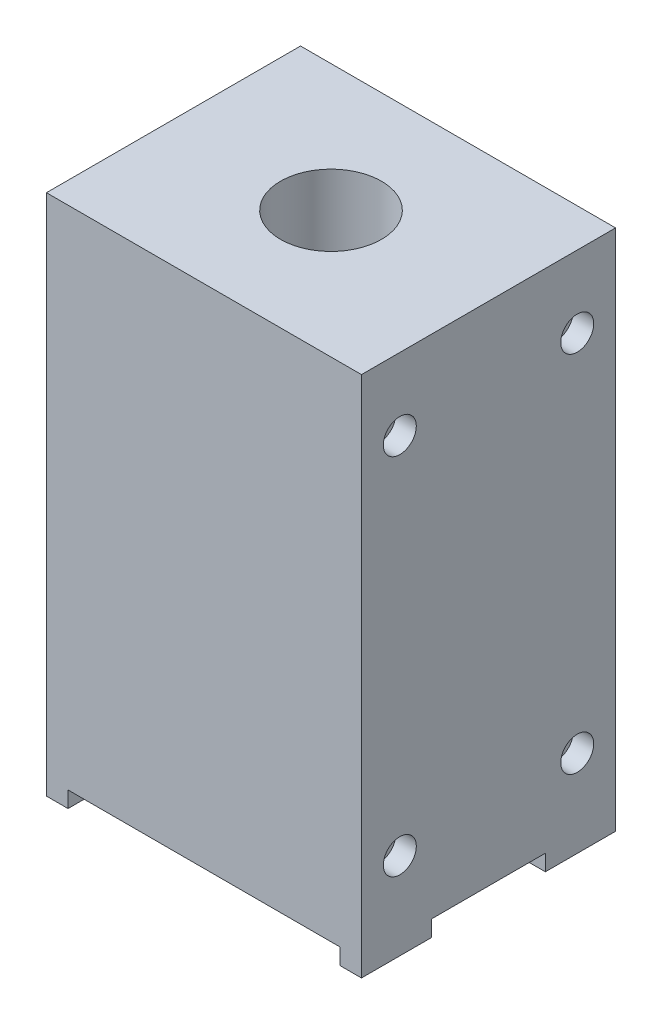
from build123d import *

# Parameters (mm, degrees)
BOSS_EXTRUDE1_DEPTH = 49.27
SKETCH12_W          = 2.099999999999998
SKETCH12_H          = 6.83
SKETCH12_W_2        = 2.0999999999999996
SKETCH12_H_2        = 6.829999999999998
SKETCH12_W_3        = 2.1000000000000014
BOSS_EXTRUDE2_DEPTH = 1.57
SKETCH4_R           = 4.91
CUT_EXTRUDE3_DEPTH  = 22
SKETCH5_R           = 2
CUT_EXTRUDE4_DEPTH  = 5
SKETCH7_R           = 1.5
CUT_EXTRUDE5_DEPTH  = 34.41594267711148
FILLET4_R           = 3
FILLET5_R           = 3
SKETCH13_R          = 1.6049999999999995
SKETCH13_R_2        = 1.6049999999999962
SKETCH13_R_3        = 1.605
CUT_EXTRUDE6_DEPTH  = 2


with BuildPart() as part:
    # Sketch2 → Boss-Extrude1 (new body)
    with BuildSketch(Plane(origin=(0, 0, 0), x_dir=(1, 0, 0), z_dir=(0, 1, 0))):
        Polygon((-15.325000000000001, 12.36), (15.324999999999998, 12.36), (15.325, -12.360000000000003), (-15.324999999999996, -12.360000000000003), align=None)
    extrude(amount=BOSS_EXTRUDE1_DEPTH)

    # Sketch12 → Boss-Extrude2 (add)
    with BuildSketch(Plane.XZ):
        with Locations((-14.274999999999997, 8.945000000000004)):
            Rectangle(SKETCH12_W, SKETCH12_H)
        with Locations((-14.275000000000002, -8.944999999999999)):
            Rectangle(SKETCH12_W_2, SKETCH12_H_2)
        with Locations((14.274999999999999, 8.945000000000004)):
            Rectangle(SKETCH12_W_3, SKETCH12_H)
        with Locations((14.274999999999999, -8.944999999999999)):
            Rectangle(SKETCH12_W_3, SKETCH12_H_2)
    extrude(amount=BOSS_EXTRUDE2_DEPTH)

    # Sketch4 → Cut-Extrude3 (cut)
    with BuildSketch(Plane(origin=(0, 49.27, 0), x_dir=(1, 0, 0), z_dir=(0, 1, 0))):
        with Locations(Location((0, 0, 0), (0, 0, 270))):
            Circle(SKETCH4_R)
    extrude(amount=-CUT_EXTRUDE3_DEPTH, mode=Mode.SUBTRACT)

    # Sketch5 → Cut-Extrude4 (cut)
    with BuildSketch(Plane(origin=(0, 27.270000000000003, 0), x_dir=(1, 0, 0), z_dir=(0, 1, 0))):
        with Locations(Location((0, 0, 0), (0, 0, 270))):
            Circle(SKETCH5_R)
    extrude(amount=-CUT_EXTRUDE4_DEPTH, mode=Mode.SUBTRACT)

    # Sketch7 → Cut-Extrude5 (cut, through all)
    with BuildSketch(Plane(origin=(0, 22.270000000000003, 0), x_dir=(1, 0, 0), z_dir=(0, 1, 0))):
        with Locations(Location((0, 0, 0), (0, 0, 270))):
            Circle(SKETCH7_R)
    extrude(amount=-CUT_EXTRUDE5_DEPTH, mode=Mode.SUBTRACT)

    # Fillet4
    # the kernel refuses this fillet: 3 mm, written as the material it takes off along each edge
    with BuildSketch(Plane(origin=(0, 27.270000000000003, 0), x_dir=(-1.8e-16, 0, 1), z_dir=(-1, 0, -1.8e-16))) as fillet4_piece_1:
        with BuildLine():
            CenterArc((5, -2.9986496961132367), FILLET4_R, 91.7191313208778, 88.2808686791222)
            Line((2, -2.9986496961132367), (1.94, -2.9986496961132367))
            Line((1.94, -2.9986496961132367), (1.94, 0))
            Line((1.94, 0), (2, 0.05999999999999872))
            ThreePointArc((2, 0.05999999999999872), (3.455, 0.05999999999999872), (4.9082, 0.05997299392226552))
            Line((4.9082, 0.05997299392226552), (4.91, 0))
        make_face()
    revolve(axis=Axis((0, 27.270000000000003, 0), (0, 1, 0)), mode=Mode.SUBTRACT)

    # Fillet5
    # the kernel refuses this fillet: 3 mm, written as the material it takes off along each edge
    with BuildSketch(Plane(origin=(0, 22.270000000000003, 0), x_dir=(-1.8e-16, 0, 1), z_dir=(-1, 0, -1.8e-16))) as fillet5_piece_1:
        with BuildLine():
            CenterArc((4.5, -1.6583123951831418), FILLET5_R, 146.44269023799268, 33.55730976200732)
            Line((2.0000000000025064, -1.66267e-12), (1.9500000000025566, 0.03316624790196698))
            ThreePointArc((1.9500000000025566, 0.03316624790196698), (1.7500000000012532, 0.05999999999999872), (1.5, 0.05999999999999872))
            Line((1.5, 0.05999999999999872), (1.44, 0))
            Line((1.44, 0), (1.44, -1.6583123951831418))
            Line((1.44, -1.6583123951831418), (1.5, -1.6583123951831418))
        make_face()
    revolve(axis=Axis((0, 22.270000000000003, 0), (0, 1, 0)), mode=Mode.SUBTRACT)

    # Sketch13 → Cut-Extrude6 (cut)
    with BuildSketch(Plane(origin=(15.324999999999998, 0, -1.08e-15), x_dir=(-7e-17, 0, -1), z_dir=(1, 0, -7e-17))):
        with Locations((-8.630000000000006, 42.27)):
            Circle(SKETCH13_R)
        with Locations((8.629999999999999, 42.27)):
            Circle(SKETCH13_R_2)
        with Locations((-8.630000000000006, 6.870000000000001)):
            Circle(SKETCH13_R_3)
        with Locations((8.629999999999999, 6.870000000000001)):
            Circle(SKETCH13_R_3)
    extrude(amount=-CUT_EXTRUDE6_DEPTH, mode=Mode.SUBTRACT)


solid = part.part
